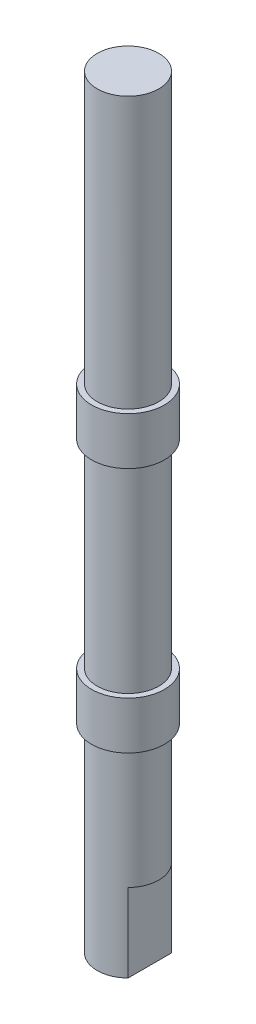
from build123d import *
from build123d.topology import SkipClean

# Parameters (mm, degrees)
SKETCH_1_R      = 2.75
EXTRUDE_1_DEPTH = 61.2
EXTRUDE_START   = 7
EXTRUDE_2_DEPTH = 7
EXTRUDE_START_2 = -22
SKETCH_3_R      = 3.25
EXTRUDE_3_DEPTH = 4.25
EXTRUDE_START_3 = -44
SKETCH_3_2_R    = 3.25
EXTRUDE_4_DEPTH = 4.25


with BuildPart() as part:
    # 草图1 → 凸台-拉伸1 (new body)
    with BuildSketch(Plane(origin=(0, 0, 0), x_dir=(1, 0, 0), z_dir=(0, 1, 0))):
        Circle(SKETCH_1_R)
    extrude(amount=EXTRUDE_1_DEPTH)

    # 草图2 → 凸台-拉伸2 (add)
    with SkipClean():  # the faces are left unmerged after this step: merging them gives an invalid solid
        with BuildSketch(Plane.XZ.offset(EXTRUDE_START)):
            with BuildLine():
                Line((-1.95, 1.939071943), (-1.95, -1.939071943))
                ThreePointArc((-1.95, -1.939071943), (0, -2.75), (1.95, -1.939071943))
                Line((1.95, -1.939071943), (1.95, 1.939071943))
                ThreePointArc((1.95, 1.939071943), (0, 2.75), (-1.95, 1.939071943))
            make_face()
        extrude(amount=-EXTRUDE_2_DEPTH)

    # 草图3 → 凸台-拉伸3 (add)
    with SkipClean():  # the faces are left unmerged after this step: merging them gives an invalid solid
        with BuildSketch(Plane.XZ.offset(7).offset(EXTRUDE_START_2)):
            Circle(SKETCH_3_R)
        extrude(amount=EXTRUDE_3_DEPTH)

    # 草图3<2> → 凸台-拉伸4 (add)
    with SkipClean():  # the faces are left unmerged after this step: merging them gives an invalid solid
        with BuildSketch(Plane.XZ.offset(7).offset(EXTRUDE_START_3)):
            Circle(SKETCH_3_2_R)
        extrude(amount=EXTRUDE_4_DEPTH)


solid = part.part
